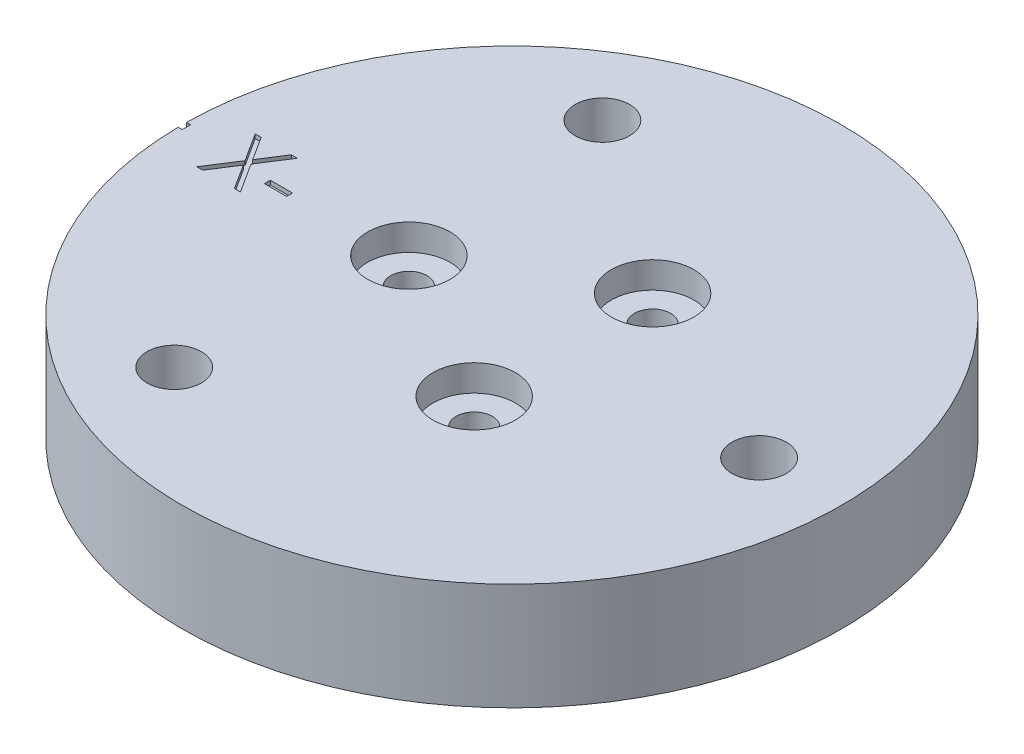
from build123d import *

# Parameters (mm, degrees)
SKETCH1_R                                        = 20
BOSS_EXTRUDE1_DEPTH                              = 6.5
CBORE_FOR_M2_PAN_HEAD_MACHINE_SCREW1_D           = 2.2
CBORE_FOR_M2_PAN_HEAD_MACHINE_SCREW1_CBORE_D     = 5
CBORE_FOR_M2_PAN_HEAD_MACHINE_SCREW1_CBORE_DEPTH = 1.6
TAP_DRILL_FOR_M4X0_7_TAP1_D                      = 3.3
SHELL1_START                                     = -6.5
SHELL1_OUTLINE_R                                 = 4.5
SHELL1_DEPTH                                     = 4.5
SHELL1_2_OUTLINE_R                               = 4.5
SHELL1_2_OUTLINE_R_2                             = 3.1
SHELL1_2_DEPTH                                   = 2.9
BOSS_EXTRUDE2_START                              = 4.5
SKETCH5_R                                        = 12
SKETCH5_R_2                                      = 1.1
BOSS_EXTRUDE2_DEPTH                              = 4.5
SKETCH6_W                                        = 1.346153846
SKETCH6_H                                        = 0.358974359
CUT_EXTRUDE1_DEPTH                               = 0.25
SKETCH7_R                                        = 0.95
BOSS_EXTRUDE3_DEPTH                              = 2.5
CUT_EXTRUDE2_DEPTH                               = 30.021543722


# Read off the part's stored shape, not the designer's step: Shell1
with BuildPart() as part:
    # Sketch1 → Boss-Extrude1 (new body)
    with BuildSketch(Plane(origin=(0, 0, 0), x_dir=(1, 0, 0), z_dir=(0, 1, 0))):
        with Locations(Location((0, 0, 0), (0, 0, 270))):
            Circle(SKETCH1_R)
    extrude(amount=-BOSS_EXTRUDE1_DEPTH)

    # CBORE for M2 Pan Head Machine Screw1 (through all)
    with Locations(Plane(origin=(3.125, 0, -5.412658774), x_dir=(0, 0, 1), z_dir=(0, 1, 0))):
        with Locations((0, 0), (5.412658774, -9.375), (10.825317548, 0)):
            CounterBoreHole(CBORE_FOR_M2_PAN_HEAD_MACHINE_SCREW1_D / 2, CBORE_FOR_M2_PAN_HEAD_MACHINE_SCREW1_CBORE_D / 2, CBORE_FOR_M2_PAN_HEAD_MACHINE_SCREW1_CBORE_DEPTH)

    # Tap Drill for M4x0.7 Tap1 (through all)
    with Locations(Plane(origin=(0, 0, 0), x_dir=(1, 0, 0), z_dir=(0, 1, 0))):
        with Locations((15, 0), (-7.5, 12.990381057), (-7.5, -12.990381057)):
            Hole(TAP_DRILL_FOR_M4X0_7_TAP1_D / 2)

    # Shell1 outline → Shell1 (cut)
    with BuildSketch(Plane(origin=(0, 0, 0), x_dir=(1, 0, 0), z_dir=(0, 1, 0)).offset(SHELL1_START)):
        with BuildLine():
            ThreePointArc((17.855916667, -2.272936425), (11.35, 0), (17.855916667, 2.272936425))
            ThreePointArc((17.855916667, 2.272936425), (9, 15.588457268), (-6.959537648, 16.600145654))
            ThreePointArc((-6.959537648, 16.600145654), (-5.675, 9.829388333), (-10.896379019, 14.327209229))
            ThreePointArc((-10.896379019, 14.327209229), (-18, 0), (-10.896379019, -14.327209229))
            ThreePointArc((-10.896379019, -14.327209229), (-5.675, -9.829388333), (-6.959537648, -16.600145654))
            ThreePointArc((-6.959537648, -16.600145654), (9, -15.588457268), (17.855916667, -2.272936425))
        make_face()
        with Locations((-6.25, 0)):
            Circle(SHELL1_OUTLINE_R, mode=Mode.SUBTRACT)
        with Locations((3.125, -5.412658774)):
            Circle(SHELL1_OUTLINE_R, mode=Mode.SUBTRACT)
        with Locations((3.125, 5.412658774)):
            Circle(SHELL1_OUTLINE_R, mode=Mode.SUBTRACT)
    extrude(amount=SHELL1_DEPTH, mode=Mode.SUBTRACT)

    # Shell1 2 outline → Shell1 2 (cut)
    # profile 1 of 3: a face of its own
    with BuildSketch(Plane(origin=(0, 0, 0), x_dir=(1, 0, 0), z_dir=(0, 1, 0)).offset(SHELL1_START)):
        with Locations((3.125, -5.412658774)):
            Circle(SHELL1_2_OUTLINE_R)
        with Locations((3.125, -5.412658774)):
            Circle(SHELL1_2_OUTLINE_R_2, mode=Mode.SUBTRACT)
    # profile 2 of 3: a face of its own
    with BuildSketch(Plane(origin=(0, 0, 0), x_dir=(1, 0, 0), z_dir=(0, 1, 0)).offset(SHELL1_START)):
        with Locations((-6.25, 0)):
            Circle(SHELL1_2_OUTLINE_R)
        with Locations((-6.25, 0)):
            Circle(SHELL1_2_OUTLINE_R_2, mode=Mode.SUBTRACT)
    # profile 3 of 3: a face of its own
    with BuildSketch(Plane(origin=(0, 0, 0), x_dir=(1, 0, 0), z_dir=(0, 1, 0)).offset(SHELL1_START)):
        with Locations((3.125, 5.412658774)):
            Circle(SHELL1_2_OUTLINE_R)
        with Locations((3.125, 5.412658774)):
            Circle(SHELL1_2_OUTLINE_R_2, mode=Mode.SUBTRACT)
    extrude(amount=SHELL1_2_DEPTH, mode=Mode.SUBTRACT)

    # Sketch5 → Boss-Extrude2 (add)
    with BuildSketch(Plane.XZ.offset(2).offset(BOSS_EXTRUDE2_START)):
        Circle(SKETCH5_R)
        with Locations(Location((3.125, -5.412658774, 0), (0, 0, 90))):
            Circle(SKETCH5_R_2, mode=Mode.SUBTRACT)
        with Locations(Location((-6.25, 0, 0), (0, 0, 90))):
            Circle(SKETCH5_R_2, mode=Mode.SUBTRACT)
        with Locations(Location((3.125, 5.412658774, 0), (0, 0, 90))):
            Circle(SKETCH5_R_2, mode=Mode.SUBTRACT)
    extrude(amount=-BOSS_EXTRUDE2_DEPTH)

    # Sketch6 → Cut-Extrude1 (cut)
    with BuildSketch(Plane(origin=(0, 0, 0), x_dir=(1, 0, 0), z_dir=(0, 1, 0))):
        Polygon((-17.309082509, 1.733907393), (-16.946602541, 1.733907393), (-16.030236355, 0.302216688), (-15.11387017, 1.733907393), (-14.751390202, 1.733907393), (-15.848645811, 0.018963483), (-14.706518407, -1.766092607), (-15.068998375, -1.766092607), (-16.030236355, -0.264289722), (-16.991474336, -1.766092607), (-17.353954304, -1.766092607), (-16.211125779, 0.018963483), align=None)
        with Locations((-13.741774817, -0.419938761)):
            Rectangle(SKETCH6_W, SKETCH6_H)
    extrude(amount=-CUT_EXTRUDE1_DEPTH, mode=Mode.SUBTRACT)

    # Sketch7 → Boss-Extrude3 (add)
    with BuildSketch(Plane.XZ.offset(6.5)):
        with Locations(Location((6.248, 0, 0), (0, 0, 90))):
            Circle(SKETCH7_R)
        with Locations(Location((-3.125, -5.410349249, 0), (0, 0, 90))):
            Circle(SKETCH7_R)
    extrude(amount=BOSS_EXTRUDE3_DEPTH)

    # Sketch9 → Cut-Extrude2 (cut, through all)
    with BuildSketch(Plane.XZ.offset(6.5)):
        with BuildLine():
            Line((-19.748437439, 0.25), (-19.748437439, -0.25))
            Line((-19.748437439, -0.25), (-19.998437439, -0.25))
            ThreePointArc((-19.998437439, -0.25), (-20, 0), (-19.998437439, 0.25))
            Line((-19.998437439, 0.25), (-19.748437439, 0.25))
        make_face()
    extrude(amount=-CUT_EXTRUDE2_DEPTH, mode=Mode.SUBTRACT)


solid = part.part
